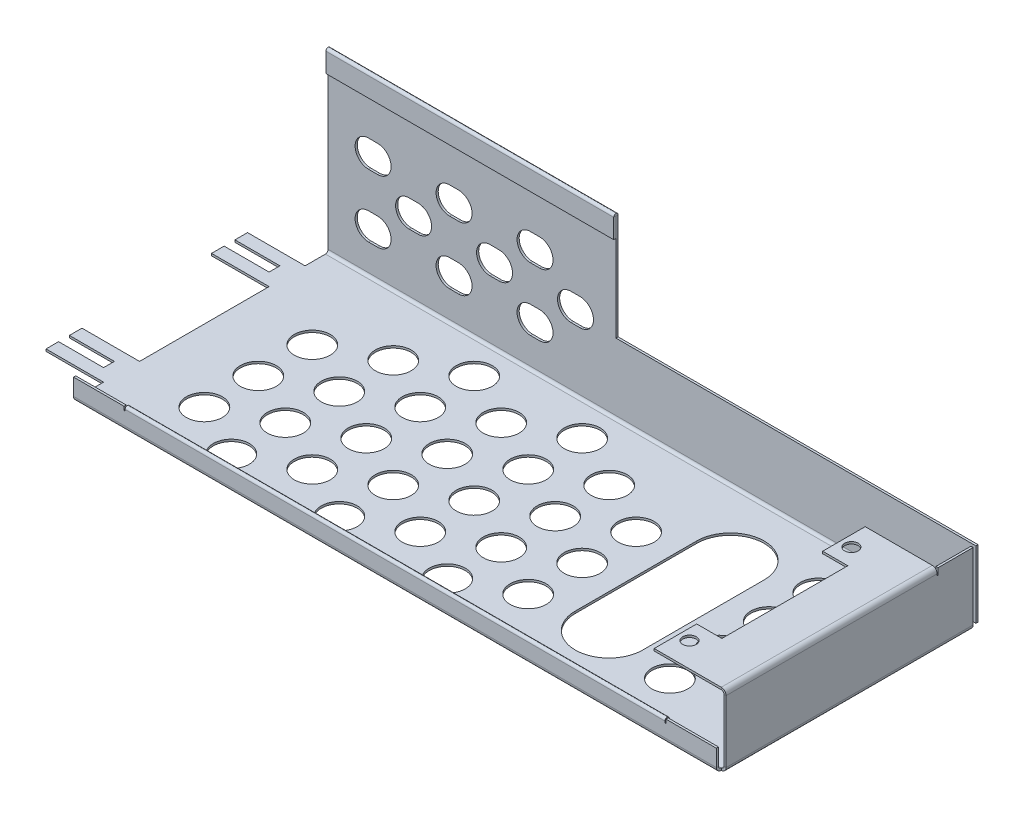
from build123d import *

# Parameters (mm, degrees)
SKETCH1_W                        = 457.2
SKETCH1_H                        = 177.8
BASE_FLANGE1_DEPTH               = 1.51892
EDGE_FLANGE1_STRIP_W             = 9.88568
EDGE_FLANGE1_STRIP_H             = 1.51892
EDGE_FLANGE1_STRIP_CUT_DEPTH     = 457.2
EDGE_FLANGE1_DEPTH               = 457.2
EDGE_FLANGE1_FLAT_DEPTH          = 1.51892
EDGE_FLANGE2_START               = -90
EDGE_FLANGE2_DEPTH               = 178.9
EDGE_FLANGE2_2_DEPTH             = 4.52392
EDGE_FLANGE2_START_2             = -85.47608
EDGE_FLANGE2_3_DEPTH             = 174.37608
EDGE_FLANGE3_START               = -60.07608
EDGE_FLANGE3_OUTLINE_W           = 17.78
EDGE_FLANGE3_OUTLINE_H           = 1.51892
EDGE_FLANGE3_DEPTH               = 30.03804
EDGE_FLANGE3_START_2             = 58.86196
EDGE_FLANGE3_2_OUTLINE_W         = 17.78
EDGE_FLANGE3_2_OUTLINE_H         = 1.51892
EDGE_FLANGE3_2_DEPTH             = 30.03804
EDGE_FLANGE3_START_3             = -60.83554
EDGE_FLANGE3_3_DEPTH             = 149.73554
EDGE_FLANGE3_4_DEPTH             = 148.97608
EDGE_FLANGE3_START_4             = 225.17608
EDGE_FLANGE3_5_DEPTH             = 4.82392
F_1_1_DIAMETER_HOLE2_D           = 25.4
LPATTERN1_COUNT                  = 4
LPATTERN1_PITCH                  = 34.925
HEM1_START                       = -228.6
HEM1_DEPTH                       = 203.2
HEM1_2_DEPTH                     = 203.2
LARGE_SLOT_CUTOUT_DEPTH          = 1.51892
TAB1_DEPTH                       = 1.51892
F_3_8_0_375_DIAMETER_HOLE1_D     = 9.525
F_3_8_0_375_DIAMETER_HOLE1_DEPTH = 1.51892
EDGE_FLANGE4_DEPTH               = 453.77608
HEM2_START                       = 90.805
HEM2_DEPTH                       = 1.51892
HEM2_START_2                     = -192.21196
HEM2_2_DEPTH                     = 381
HEM2_3_DEPTH                     = 381
SMALL_SLOT_CUTOUT_DEPTH          = 1.51892
LPATTERN2_COUNT                  = 6
LPATTERN2_PITCH                  = 28.575
LPATTERN2_COUNT_DIR2             = 3
LPATTERN2_PITCH_DIR2             = 22.225


with BuildPart() as part:
    # Base-Flange1: sheet metal written as solids
    # Sketch1 → Base-Flange1 (new body)
    with BuildSketch(Plane(origin=(0, 0, 0), x_dir=(1, 0, 0), z_dir=(0, 1, 0))):
        Rectangle(SKETCH1_W, SKETCH1_H)
    extrude(amount=-BASE_FLANGE1_DEPTH)

    # Edge-Flange1: sheet metal written as solids
    # Edge-Flange1 strip (on a plane across the edge) → Edge-Flange1 strip cut (cut)
    with BuildSketch(Plane(origin=(228.6, 0, -88.9), x_dir=(0, 0, 1), z_dir=(-1, 0, 0))):
        with Locations((-1.51892, -0.75946)):
            Rectangle(EDGE_FLANGE1_STRIP_W, EDGE_FLANGE1_STRIP_H)
    extrude(amount=EDGE_FLANGE1_STRIP_CUT_DEPTH, mode=Mode.SUBTRACT)

    # Edge-Flange1 bend section (on a plane across the edge) → Edge-Flange1 (add)
    with BuildSketch(Plane(origin=(228.6, 0, -88.9), x_dir=(0, 0, 1), z_dir=(-1, 0, 0))):
        with BuildLine():
            Line((0, 1.905), (1.51892, 1.905))
            ThreePointArc((1.51892, 1.905), (2.076881582, 0.557961582), (3.42392, 0))
            Line((3.42392, 0), (3.42392, -1.51892))
            ThreePointArc((3.42392, -1.51892), (1.00284295, -0.51607705), (0, 1.905))
        make_face()
    extrude(amount=EDGE_FLANGE1_DEPTH)

    # Edge-Flange1 profile (on flange) → Edge-Flange1 flat (add)
    with BuildSketch(Plane(origin=(0, 0, -88.9), x_dir=(-1, 0, 0), z_dir=(0, 0, -1))):
        Polygon((-228.6, 49.28108), (-228.6, 1.905), (228.6, 1.905), (228.6, 125.48108), (25.4, 125.48108), (25.4, 49.28108), align=None)
    extrude(amount=-EDGE_FLANGE1_FLAT_DEPTH)

    # Edge-Flange2: read off the stored shape, not the designer's step
    # Edge-Flange2 outline → Edge-Flange2 (cut)
    with BuildSketch(Plane.XY.offset(EDGE_FLANGE2_START)):
        with BuildLine():
            Line((227.08108, 1.905), (225.17608, 1.905))
            Line((225.17608, 1.905), (225.17608, 0))
            ThreePointArc((225.17608, 0), (226.523118418, 0.557961582), (227.08108, 1.905))
        make_face()
        with BuildLine():
            ThreePointArc((228.6, 1.905), (227.59715705, -0.51607705), (225.17608, -1.51892))
            Line((225.17608, -1.51892), (228.6, -1.51892))
            Line((228.6, -1.51892), (228.6, 1.905))
        make_face()
    extrude(amount=EDGE_FLANGE2_DEPTH, mode=Mode.SUBTRACT)

    # Edge-Flange2 2 outline → Edge-Flange2 2 (cut)
    with BuildSketch(Plane.XY.offset(EDGE_FLANGE2_START)):
        with BuildLine():
            Line((228.6, 1.905), (227.08108, 1.905))
            ThreePointArc((227.08108, 1.905), (226.523118418, 0.557961582), (225.17608, 0))
            Line((225.17608, 0), (225.17608, -1.51892))
            ThreePointArc((225.17608, -1.51892), (227.59715705, -0.51607705), (228.6, 1.905))
        make_face()
    extrude(amount=EDGE_FLANGE2_2_DEPTH, mode=Mode.SUBTRACT)

    # Edge-Flange2 3 outline → Edge-Flange2 3 (add)
    with BuildSketch(Plane.XY.offset(EDGE_FLANGE2_START_2)):
        with BuildLine():
            Line((227.08108, 49.28108), (227.08108, 1.905))
            ThreePointArc((227.08108, 1.905), (226.523118418, 0.557961582), (225.17608, 0))
            Line((225.17608, 0), (228.021111312, 0))
            ThreePointArc((228.021111312, 0), (228.45208273, 0.909492954), (228.6, 1.905))
            Line((228.6, 1.905), (228.6, 49.28108))
            Line((228.6, 49.28108), (227.08108, 49.28108))
        make_face()
    extrude(amount=EDGE_FLANGE2_3_DEPTH)

    # Edge-Flange3 3 outline → Edge-Flange3 3 (cut)
    with BuildSketch(Plane.XY.offset(EDGE_FLANGE3_START_3)):
        with BuildLine():
            Line((227.08108, 49.28108), (227.08108, 48.702191312))
            ThreePointArc((227.08108, 48.702191312), (228.196493528, 47.469713963), (228.6, 45.85716))
            Line((228.6, 45.85716), (228.6, 49.28108))
            Line((228.6, 49.28108), (227.08108, 49.28108))
        make_face()
    extrude(amount=EDGE_FLANGE3_3_DEPTH, mode=Mode.SUBTRACT)



with BuildPart() as body_2:
    # Edge-Flange3: read off the stored shape, not the designer's step
    # Edge-Flange3 outline → Edge-Flange3 (new body)
    with BuildSketch(Plane.XY.offset(EDGE_FLANGE3_START)):
        with Locations((186.69, 48.52162)):
            Rectangle(EDGE_FLANGE3_OUTLINE_W, EDGE_FLANGE3_OUTLINE_H)
    extrude(amount=EDGE_FLANGE3_DEPTH)


with BuildPart() as body_3:
    # Edge-Flange3 2 outline → Edge-Flange3 2 (new body)
    with BuildSketch(Plane.XY.offset(EDGE_FLANGE3_START_2)):
        with Locations((186.69, 48.52162)):
            Rectangle(EDGE_FLANGE3_2_OUTLINE_W, EDGE_FLANGE3_2_OUTLINE_H)
    extrude(amount=EDGE_FLANGE3_2_DEPTH)


with BuildPart() as part_1:
    add(part.part)

    add(body_2.part)  # Edge-Flange3 4 merges body 2

    add(body_3.part)  # Edge-Flange3 4 merges body 3
    # Edge-Flange3 4 outline → Edge-Flange3 4 (add)
    with BuildSketch(Plane.XY.offset(EDGE_FLANGE3_START)):
        with BuildLine():
            ThreePointArc((227.08108, 48.702191312), (226.171587046, 49.13316273), (225.17608, 49.28108))
            Line((225.17608, 49.28108), (195.58, 49.28108))
            Line((195.58, 49.28108), (195.58, 47.76216))
            Line((195.58, 47.76216), (225.17608, 47.76216))
            ThreePointArc((225.17608, 47.76216), (226.523118418, 47.204198418), (227.08108, 45.85716))
            Line((227.08108, 45.85716), (227.08108, 48.702191312))
        make_face()
    extrude(amount=EDGE_FLANGE3_4_DEPTH)

    # Edge-Flange3 5 outline → Edge-Flange3 5 (cut)
    with BuildSketch(Plane.YZ.offset(EDGE_FLANGE3_START_4)):
        with BuildLine():
            Line((50, -60.07608), (45.0977, -60.07608))
            ThreePointArc((45.0977, -60.07608), (44.71797, -60.45581), (45.0977, -60.83554))
            Line((45.0977, -60.83554), (50, -60.83554))
            Line((50, -60.83554), (50, -60.07608))
        make_face()
    extrude(amount=EDGE_FLANGE3_5_DEPTH, mode=Mode.SUBTRACT)

    # 1 (1) Diameter Hole2 (through all)
    with Locations(Plane(origin=(0, 0, 0), x_dir=(-1, 0, 0), z_dir=(0, 1, 0))):
        with Locations((-152.4, -52.3875)):
            f_1_1_diameter_hole2 = Hole(F_1_1_DIAMETER_HOLE2_D / 2)

    # LPattern1: 1 (1) Diameter Hole2 ×4
    with Locations(*[(0, 0, i * LPATTERN1_PITCH) for i in range(1, LPATTERN1_COUNT)]):
        add(f_1_1_diameter_hole2, mode=Mode.SUBTRACT)

    # Sketch15 → 1 (1) Diameter Hole1 (revolve, cut)
    with BuildSketch(Plane(origin=(-177.8, 0, 50.8), x_dir=(0, 0, 1), z_dir=(1, 0, 0))):
        Polygon((0, 0), (0, 331.480929862), (12.7, 323.85), (12.7, 0), align=None)
    f_1_1_diameter_hole1 = revolve(axis=Axis((-177.8, 6.35, 50.8), (0, -1, 0)), mode=Mode.SUBTRACT)

    # Sketch-Pattern3: 1 (1) Diameter Hole1 at 25 more places
    with Locations((0, 0, -38.1), (0, 0, -76.2), (38.1, 0, 19.05), (76.2, 0, 0), (76.2, 0, -38.1), (38.1, 0, -95.25), (152.4, 0, 0), (152.4, 0, -38.1), (152.4, 0, -76.2), (76.2, 0, -76.2), (228.6, 0, 0), (228.6, 0, -38.1), (228.6, 0, -76.2), (190.5, 0, 19.05), (190.5, 0, -19.05), (190.5, 0, -57.15), (190.5, 0, -95.25), (38.1, 0, -19.05), (38.1, 0, -57.15), (114.3, 0, -19.05), (114.3, 0, -57.15), (114.3, 0, 19.05), (114.3, 0, -95.25), (152.4, 0, -114.3), (76.2, 0, -114.3)):
        add(f_1_1_diameter_hole1, mode=Mode.SUBTRACT)

    # Hem1: read off the stored shape, not the designer's step
    # Hem1 outline → Hem1 (cut)
    with BuildSketch(Plane.YZ.offset(HEM1_START)):
        with BuildLine():
            Line((125.48108, -87.38108), (125.480283071, -87.38108))
            ThreePointArc((125.480283071, -87.38108), (125.003733169, -88.458012999), (123.91216, -88.9))
            Line((123.91216, -88.9), (125.48108, -88.9))
            Line((125.48108, -88.9), (125.48108, -87.38108))
        make_face()
    extrude(amount=HEM1_DEPTH, mode=Mode.SUBTRACT)

    # Hem1 2 outline → Hem1 2 (add)
    with BuildSketch(Plane.YZ.offset(HEM1_START)):
        with BuildLine():
            Line((110.24108, -85.76216), (110.24108, -87.28108))
            Line((110.24108, -87.28108), (123.91216, -87.28108))
            ThreePointArc((123.91216, -87.28108), (123.96216, -87.33108), (123.91216, -87.38108))
            Line((123.91216, -87.38108), (125.480283071, -87.38108))
            ThreePointArc((125.480283071, -87.38108), (125.039092999, -86.239506831), (123.91216, -85.76216))
            Line((123.91216, -85.76216), (110.24108, -85.76216))
        make_face()
    extrude(amount=HEM1_2_DEPTH)

    # Sketch23 → Large Slot Cutout (cut)
    with BuildSketch(Plane(origin=(0, 0, 0), x_dir=(1, 0, 0), z_dir=(0, 1, 0))):
        with BuildLine():
            Line((125.4125, 41.15054), (125.4125, -44.57446))
            ThreePointArc((125.4125, -44.57446), (101.6, -68.38696), (77.7875, -44.57446))
            Line((77.7875, -44.57446), (77.7875, 41.15054))
            ThreePointArc((77.7875, 41.15054), (101.6, 64.96304), (125.4125, 41.15054))
        make_face()
    extrude(amount=-LARGE_SLOT_CUTOUT_DEPTH, mode=Mode.SUBTRACT)

    # Tab1: sheet metal written as solids
    # Sketch24 → Tab1 (add)
    with BuildSketch(Plane(origin=(0, 0, 0), x_dir=(1, 0, 0), z_dir=(0, 1, 0))):
        Polygon((-228.6, -71.12), (-269.24, -71.12), (-269.24, -62.23), (-237.485090031, -62.23), (-237.485090031, -54.61), (-269.24, -54.61), (-269.24, -45.72), (-228.6, -45.72), align=None)
    tab1 = extrude(amount=-TAB1_DEPTH)

    # Mirror1: Tab1 across plane
    add(tab1.mirror(Plane.XY))

    # 3/8 (0.375) Diameter Hole1
    with Locations(Plane(origin=(0, 49.28108, 0), x_dir=(-1, 0, 0), z_dir=(0, 1, 0))):
        with Locations((-185.42, 71.56196), (-185.42, -42.73804)):
            Hole(F_3_8_0_375_DIAMETER_HOLE1_D / 2, depth=F_3_8_0_375_DIAMETER_HOLE1_DEPTH)

    # Edge-Flange4: sheet metal written as solids
    # Edge-Flange4 section (on a plane across the edge) → Edge-Flange4 (add)
    with BuildSketch(Plane(origin=(-228.6, 0, 90.805), x_dir=(0, 0, -1), z_dir=(1, 0, 0))):
        with BuildLine():
            Line((-1.51892, 1.905), (-1.51892, 13.72108))
            Line((-1.51892, 13.72108), (0, 13.72108))
            Line((0, 13.72108), (0, 1.905))
            ThreePointArc((0, 1.905), (0.557961582, 0.557961582), (1.905, 0))
            Line((1.905, 0), (1.905, -1.51892))
            ThreePointArc((1.905, -1.51892), (-0.51607705, -0.51607705), (-1.51892, 1.905))
        make_face()
    extrude(amount=EDGE_FLANGE4_DEPTH)

    # Hem2: read off the stored shape, not the designer's step
    # Hem2 outline → Hem2 (cut)
    with BuildSketch(Plane.XY.offset(HEM2_START)):
        with BuildLine():
            Line((-192.97142, 13.72108), (-192.97142, 11.3927))
            ThreePointArc((-192.97142, 11.3927), (-192.59169, 11.01297), (-192.21196, 11.3927))
            Line((-192.21196, 11.3927), (-192.21196, 13.72108))
            Line((-192.21196, 13.72108), (-192.97142, 13.72108))
        make_face()
        with BuildLine():
            Line((189.5475, 13.72108), (188.78804, 13.72108))
            Line((188.78804, 13.72108), (188.78804, 11.3927))
            ThreePointArc((188.78804, 11.3927), (189.16777, 11.01297), (189.5475, 11.3927))
            Line((189.5475, 11.3927), (189.5475, 13.72108))
        make_face()
    extrude(amount=HEM2_DEPTH, mode=Mode.SUBTRACT)

    # Hem2 2 outline → Hem2 2 (cut)
    with BuildSketch(Plane.YZ.offset(HEM2_START_2)):
        with BuildLine():
            ThreePointArc((12.15216, 92.32392), (13.243733169, 91.881932999), (13.720283071, 90.805))
            Line((13.720283071, 90.805), (13.72108, 90.805))
            Line((13.72108, 90.805), (13.72108, 92.32392))
            Line((13.72108, 92.32392), (12.15216, 92.32392))
        make_face()
    extrude(amount=HEM2_2_DEPTH, mode=Mode.SUBTRACT)

    # Hem2 3 outline → Hem2 3 (add)
    with BuildSketch(Plane.YZ.offset(HEM2_START_2)):
        with BuildLine():
            Line((6.73608, 90.705), (6.73608, 89.18608))
            Line((6.73608, 89.18608), (12.15216, 89.18608))
            ThreePointArc((12.15216, 89.18608), (13.279092999, 89.663426831), (13.720283071, 90.805))
            Line((13.720283071, 90.805), (12.15216, 90.805))
            ThreePointArc((12.15216, 90.805), (12.20216, 90.755), (12.15216, 90.705))
            Line((12.15216, 90.705), (6.73608, 90.705))
        make_face()
    extrude(amount=HEM2_3_DEPTH)

    # Sketch32 → Small Slot Cutout (cut)
    with BuildSketch(Plane.XY.offset(-87.38108)):
        with BuildLine():
            Line((-200.025, 84.20608), (-193.675, 84.20608))
            ThreePointArc((-193.675, 84.20608), (-184.15, 74.68108), (-193.675, 65.15608))
            Line((-193.675, 65.15608), (-200.025, 65.15608))
            ThreePointArc((-200.025, 65.15608), (-209.55, 74.68108), (-200.025, 84.20608))
        make_face()
    small_slot_cutout = extrude(amount=-SMALL_SLOT_CUTOUT_DEPTH, mode=Mode.SUBTRACT)

    # LPattern2: Small Slot Cutout 6 × 3, 9 skipped
    with Locations(*[(i * LPATTERN2_PITCH, -j * LPATTERN2_PITCH_DIR2, 0) for i in range(LPATTERN2_COUNT) for j in range(LPATTERN2_COUNT_DIR2) if (i, j) not in ((0, 0), (0, 1), (1, 0), (1, 2), (2, 1), (3, 0), (3, 2), (4, 1), (5, 0), (5, 2))]):
        add(small_slot_cutout, mode=Mode.SUBTRACT)


solid = part_1.part
